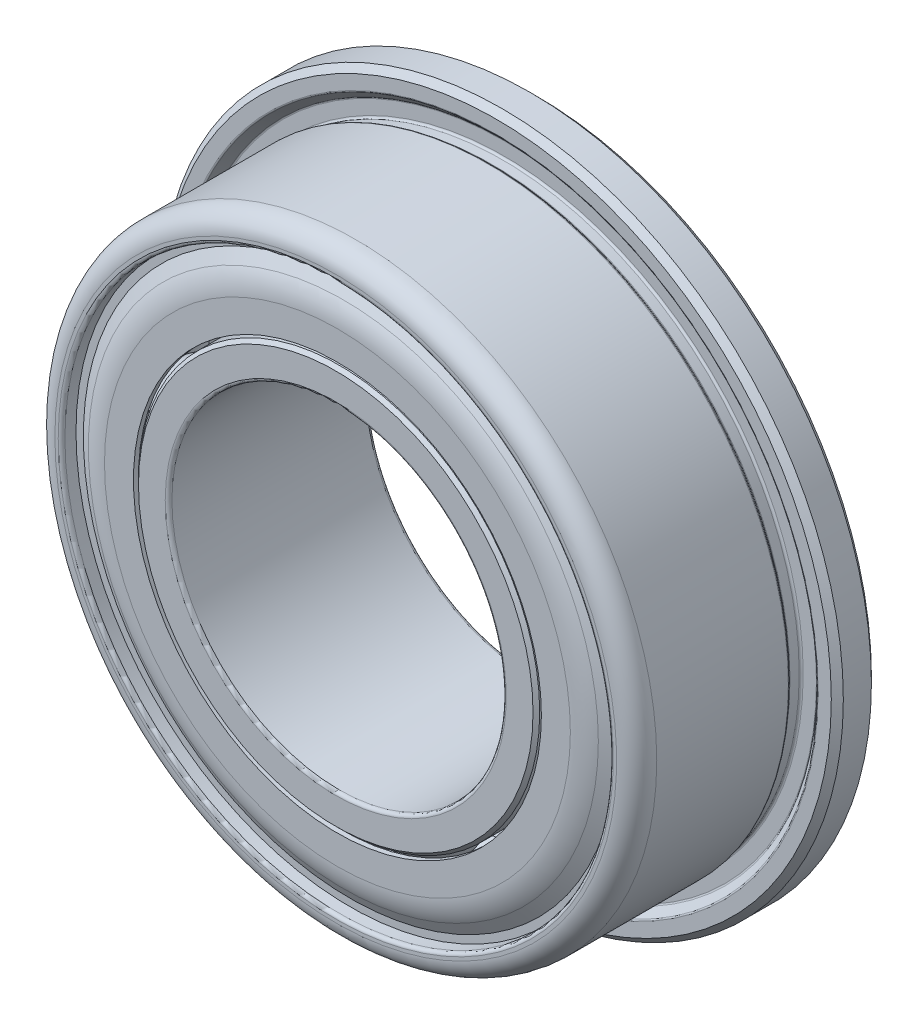
from build123d import *

# Parameters (mm, degrees)
CIRPATTERN1_COUNT  = 8
SKETCH9_R          = 3.05
CUT_EXTRUDE1_DEPTH = 8.025
SKETCH7_W          = 0.6
SKETCH7_H          = 1
FILLET2_R          = 0.3
FILLET3_R          = 0.05
FILLET5_R          = 0.03
CHAMFER1_SIZE      = 0.09
FILLET7_R          = 0.05


with BuildPart() as part:
    # Sketch3 → Revolve1 (revolve)
    with BuildSketch(Plane(origin=(0, 0, 0), x_dir=(0, 0, -1), z_dir=(1, 0, 0)), mode=Mode.PRIVATE) as revolve1_sk:
        with BuildLine():
            Line((-1.5, 4.5), (-1.5, 4.1))
            Line((-1.5, 4.1), (-0.660602809, 4.1))
            Line((-0.660602809, 4.1), (-0.660602809, 3.88))
            Line((-0.660602809, 3.88), (-0.460602809, 3.88))
            ThreePointArc((-0.460602809, 3.88), (0, 4.080180209), (0.460602809, 3.88))
            Line((0.460602809, 3.88), (0.660602809, 3.88))
            Line((0.660602809, 3.88), (0.660602809, 4.1))
            Line((0.660602809, 4.1), (1.5, 4.1))
            Line((1.5, 4.1), (1.5, 4.5))
            Line((1.5, 4.5), (-1.5, 4.5))
        make_face()
        with BuildLine():
            Line((1.5, 2.5), (-1.5, 2.5))
            Line((-1.5, 2.5), (-1.5, 3))
            Line((-1.5, 3), (-0.460602809, 3))
            ThreePointArc((-0.460602809, 3), (0, 2.820180209), (0.460602809, 3))
            Line((0.460602809, 3), (1.5, 3))
            Line((1.5, 3), (1.5, 2.5))
        make_face()
    revolve(revolve1_sk.sketch.rotate(Axis((0, 0, 1.5), (0, 0, -1)), 90), axis=Axis((0, 0, 1.5), (0, 0, -1)))

    # Sketch7 → Revolve5 (revolve)
    with BuildSketch(Plane(origin=(0, 0, 0), x_dir=(0, 0, -1), z_dir=(1, 0, 0)), mode=Mode.PRIVATE) as revolve5_sk:
        with Locations((1.2, 4.6)):
            Rectangle(SKETCH7_W, SKETCH7_H)
    revolve(revolve5_sk.sketch.rotate(Axis((0, 0, -1.5), (0, 0, 1)), 270), axis=Axis((0, 0, -1.5), (0, 0, 1)))

    # Fillet2
    fillet2_edges = [part.edges().sort_by_distance(p)[0] for p in [
        (-4.5, 0, 1.5),
    ]]
    fillet(fillet2_edges, radius=FILLET2_R)

    # Fillet3
    fillet3_edges = [part.edges().sort_by_distance(p)[0] for p in [
        (-4.1, 0, 0.660602809),
        (-4.1, 0, 1.5),
        (-4.1, 0, -1.5),
        (-4.1, 0, -0.660602809),
    ]]
    fillet(fillet3_edges, radius=FILLET3_R)

    # Fillet6
    # the kernel refuses this chamfer: 0.05 mm, written as the material it takes off along each edge
    with BuildSketch(Plane(origin=(0, 0, 1.5), x_dir=(1, 0, 0), z_dir=(0, 1, 0))) as fillet6_piece_1:
        with BuildLine():
            Line((2.948585786, -0.001414214), (3.001414214, 0.051414214))
            Line((3.001414214, 0.051414214), (3.002414214, 0.051414214))
            ThreePointArc((3.002414214, 0.051414214), (3.001, 0.025707107), (3.001, 0))
            Line((3.001, 0), (3, -0.001))
            ThreePointArc((3, -0.001), (2.974292893, -0.001), (2.948585786, -0.002414214))
            Line((2.948585786, -0.002414214), (2.948585786, -0.001414214))
        make_face()
    revolve(axis=Axis((0, 0, 1.5), (0, 0, -1)), mode=Mode.SUBTRACT)
    with BuildSketch(Plane(origin=(0, 0, 0.460602809), x_dir=(1, 0, 0), z_dir=(0, 1, 0))) as fillet6_piece_2:
        with BuildLine():
            Line((3.000701982, -0.020995836), (2.986978553, 0.01561573))
            Line((2.986978553, 0.01561573), (2.987732164, 0.016273052))
            ThreePointArc((2.987732164, 0.016273052), (2.99391746, 0.00819064), (3.000735489, 0.000677537))
            Line((3.000735489, 0.000677537), (3.001, 0))
            ThreePointArc((3.001, 0), (3.001, -0.010497918), (3.001701982, -0.020995836))
            Line((3.001701982, -0.020995836), (3.000701982, -0.020995836))
        make_face()
    revolve(axis=Axis((0, 0, 0.460602809), (0, 0, -1)), mode=Mode.SUBTRACT)
    with BuildSketch(Plane(origin=(0, 0, -0.460602809), x_dir=(1, 0, 0), z_dir=(0, 1, 0))) as fillet6_piece_3:
        with BuildLine():
            Line((3.000701982, 0.020995836), (2.986978553, -0.01561573))
            Line((2.986978553, -0.01561573), (2.987732164, -0.016273052))
            ThreePointArc((2.987732164, -0.016273052), (2.99391746, -0.00819064), (3.000735489, -0.000677537))
            Line((3.000735489, -0.000677537), (3.001, 0))
            ThreePointArc((3.001, 0), (3.001, 0.010497918), (3.001701982, 0.020995836))
            Line((3.001701982, 0.020995836), (3.000701982, 0.020995836))
        make_face()
    revolve(axis=Axis((0, 0, -0.460602809), (0, 0, -1)), mode=Mode.SUBTRACT)
    with BuildSketch(Plane(origin=(0, 0, -1.5), x_dir=(1, 0, 0), z_dir=(0, 1, 0))) as fillet6_piece_4:
        with BuildLine():
            Line((3.001414214, -0.051414214), (2.948585786, 0.001414214))
            Line((2.948585786, 0.001414214), (2.948585786, 0.002414214))
            ThreePointArc((2.948585786, 0.002414214), (2.974292893, 0.001), (3, 0.001))
            Line((3, 0.001), (3.001, 0))
            ThreePointArc((3.001, 0), (3.001, -0.025707107), (3.002414214, -0.051414214))
            Line((3.002414214, -0.051414214), (3.001414214, -0.051414214))
        make_face()
    revolve(axis=Axis((0, 0, -1.5), (0, 0, -1)), mode=Mode.SUBTRACT)

    # Sketch8 → Cut-Revolve1 (revolve, cut)
    with BuildSketch(Plane(origin=(0, 0, 0), x_dir=(0, 0, -1), z_dir=(1, 0, 0)), mode=Mode.PRIVATE) as cut_revolve1_sk:
        Polygon((0.9, 4.8), (1.02, 4.68), (1.02, 4.44), (0.84, 4.44), (0.78, 4.5), (0.9, 4.5), align=None)
    revolve(cut_revolve1_sk.sketch.rotate(Axis((0, 0, 1.5), (0, 0, -1)), 270), axis=Axis((0, 0, 1.5), (0, 0, -1)), mode=Mode.SUBTRACT)

    # Fillet5
    fillet5_edges = [part.edges().sort_by_distance(p)[0] for p in [
        (4.8, 0, -0.9),
        (0, 4.5, -0.78),
        (4.44, 0, -0.84),
        (4.44, 0, -1.02),
        (4.68, 0, -1.02),
    ]]
    fillet(fillet5_edges, radius=FILLET5_R)

    # Chamfer1
    chamfer1_edges = [part.edges().sort_by_distance(p)[0] for p in [
        (-5.1, 0, -1.5),
        (-5.1, 0, -0.9),
    ]]
    chamfer(chamfer1_edges, length=CHAMFER1_SIZE)

    # Fillet7
    fillet7_edges = [part.edges().sort_by_distance(p)[0] for p in [
        (-2.5, 0, -1.5),
        (-2.5, 0, 1.5),
    ]]
    fillet(fillet7_edges, radius=FILLET7_R)


with BuildPart() as body_2:
    # Sketch5 → Revolve3 (revolve)
    with BuildSketch(Plane(origin=(0, 0, 0), x_dir=(0, 0, -1), z_dir=(1, 0, 0))):
        with BuildLine():
            Line((-0.6, 3.450180209), (0.6, 3.450180209))
            ThreePointArc((0.6, 3.450180209), (0, 4.050180209), (-0.6, 3.450180209))
        make_face()
    revolve(axis=Axis((0, 3.450180209, 0.6), (0, 0, -1)))


with BuildPart() as cirpattern1_1:
    # CirPattern1: pattern copy
    add(body_2.part.rotate(Axis((0, 0, 0), (0, 0, 1)), 1 * 360 / CIRPATTERN1_COUNT))


with BuildPart() as cirpattern1_2:
    # CirPattern1: pattern copy
    add(body_2.part.rotate(Axis((0, 0, 0), (0, 0, 1)), 2 * 360 / CIRPATTERN1_COUNT))


with BuildPart() as cirpattern1_3:
    # CirPattern1: pattern copy
    add(body_2.part.rotate(Axis((0, 0, 0), (0, 0, 1)), 3 * 360 / CIRPATTERN1_COUNT))


with BuildPart() as cirpattern1_4:
    # CirPattern1: pattern copy
    add(body_2.part.rotate(Axis((0, 0, 0), (0, 0, 1)), 4 * 360 / CIRPATTERN1_COUNT))


with BuildPart() as cirpattern1_5:
    # CirPattern1: pattern copy
    add(body_2.part.rotate(Axis((0, 0, 0), (0, 0, 1)), 5 * 360 / CIRPATTERN1_COUNT))


with BuildPart() as cirpattern1_6:
    # CirPattern1: pattern copy
    add(body_2.part.rotate(Axis((0, 0, 0), (0, 0, 1)), 6 * 360 / CIRPATTERN1_COUNT))


with BuildPart() as cirpattern1_7:
    # CirPattern1: pattern copy
    add(body_2.part.rotate(Axis((0, 0, 0), (0, 0, 1)), 7 * 360 / CIRPATTERN1_COUNT))


with BuildPart() as body_10:
    # Sketch6 → Revolve4 (revolve)
    with BuildSketch(Plane(origin=(0, 0, 0), x_dir=(0, 0, -1), z_dir=(1, 0, 0)), mode=Mode.PRIVATE) as revolve4_sk:
        with BuildLine():
            Line((-1.475, 3), (-1.475, 3.483153533))
            ThreePointArc((-1.475, 3.483153533), (-1.452511045, 3.653974103), (-1.386576766, 3.813153533))
            Line((-1.386576766, 3.813153533), (-1.284474411, 3.99))
            Line((-1.284474411, 3.99), (-1.284474411, 4.1))
            Line((-1.284474411, 4.1), (-1.197871871, 4.1))
            Line((-1.197871871, 4.1), (-1.197871871, 3.99))
            Line((-1.197871871, 3.99), (-1.4, 3.639903811))
            Line((-1.4, 3.639903811), (-1.4, 3))
            Line((-1.4, 3), (-1.475, 3))
        make_face()
    revolve(revolve4_sk.sketch.rotate(Axis((0, 0, 1.5), (0, 0, -1)), 90), axis=Axis((0, 0, 1.5), (0, 0, -1)))


with BuildPart() as body_11:
    # Mirror1: mirrored copy
    add(body_10.part.mirror(Plane.XY))


with BuildPart() as cut_extrude1_tool:
    # Sketch9 → Cut-Extrude1 (new, through all)
    with BuildSketch(Plane.XY.offset(1.475)):
        Circle(SKETCH9_R)
    extrude(amount=-CUT_EXTRUDE1_DEPTH)


with BuildPart() as body_10_1:
    add(body_10.part)

    # Cut-Extrude1: cut by cut_extrude1_tool
    add(cut_extrude1_tool.part, mode=Mode.SUBTRACT)


with BuildPart() as body_11_1:
    add(body_11.part)

    # Cut-Extrude1: cut by cut_extrude1_tool
    add(cut_extrude1_tool.part, mode=Mode.SUBTRACT)


solid = Compound([part.part, body_2.part, cirpattern1_1.part, cirpattern1_2.part, cirpattern1_3.part, cirpattern1_4.part, cirpattern1_5.part, cirpattern1_6.part, cirpattern1_7.part, body_10_1.part, body_11_1.part])
